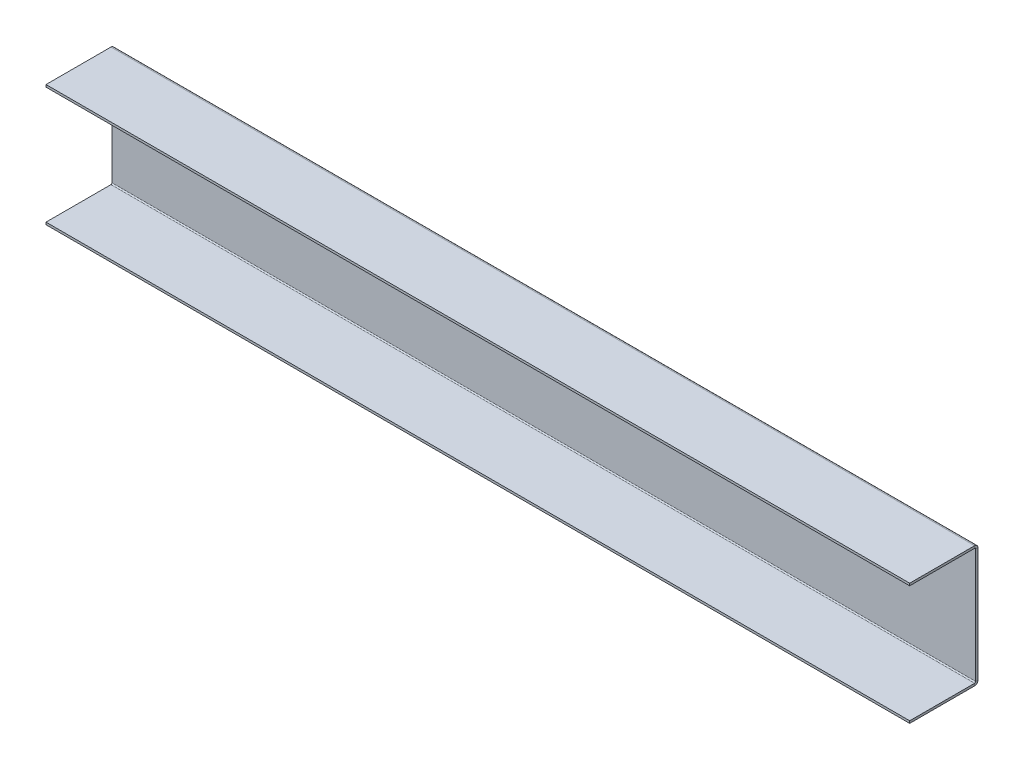
from build123d import *

# Parameters (mm, degrees)
SKETCH_1_W                         = 569
SKETCH_1_H                         = 80
SM_BASE_FLANGE_1_DEPTH             = 1.5
SM_EDGE_FLANGE_1_STRIP_W           = 7.4732
SM_EDGE_FLANGE_1_STRIP_H           = 1.5
SM_EDGE_FLANGE_1_STRIP_CUT_DEPTH   = 569
SM_EDGE_FLANGE_1_STRIP_2_W         = 7.4732
SM_EDGE_FLANGE_1_STRIP_2_H         = 1.5
SM_EDGE_FLANGE_1_STRIP_CUT_2_DEPTH = 569
SM_EDGE_FLANGE_1_DEPTH             = 569
SM_EDGE_FLANGE_1_BEND_DEPTH        = 569


# Sheet-metal steps are written as plain solids
with BuildPart() as part:
    # Sketch 1 → Базовая кромка1 (new body)
    with BuildSketch(Plane.XY):
        Rectangle(SKETCH_1_W, SKETCH_1_H)
    extrude(amount=-SM_BASE_FLANGE_1_DEPTH)

    # Ребро-кромка1 strip (across the edge) → Ребро-кромка1 strip cut (cut)
    with BuildSketch(Plane(origin=(284.5, 40, 0), x_dir=(0, -1, 0), z_dir=(-1, 0, 0))):
        with Locations((-1.5, -0.75)):
            Rectangle(SM_EDGE_FLANGE_1_STRIP_W, SM_EDGE_FLANGE_1_STRIP_H)
    extrude(amount=SM_EDGE_FLANGE_1_STRIP_CUT_DEPTH, mode=Mode.SUBTRACT)

    # Ребро-кромка1 strip 2 (across the edge) → Ребро-кромка1 strip cut 2 (cut)
    with BuildSketch(Plane(origin=(-284.5, -40, 0), x_dir=(0, 1, 0), z_dir=(1, 0, 0))):
        with Locations((-1.5, -0.75)):
            Rectangle(SM_EDGE_FLANGE_1_STRIP_2_W, SM_EDGE_FLANGE_1_STRIP_2_H)
    extrude(amount=SM_EDGE_FLANGE_1_STRIP_CUT_2_DEPTH, mode=Mode.SUBTRACT)

    # Ребро-кромка1 section (across the edge) → Ребро-кромка1 (add)
    with BuildSketch(Plane(origin=(284.5, 40, 0), x_dir=(0, -1, 0), z_dir=(-1, 0, 0))):
        with BuildLine():
            Line((0, 0.7366), (0, 43.5))
            Line((0, 43.5), (1.5, 43.5))
            Line((1.5, 43.5), (1.5, 0.7366))
            ThreePointArc((1.5, 0.7366), (1.715745145, 0.215745145), (2.2366, 0))
            Line((2.2366, 0), (2.2366, -1.5))
            ThreePointArc((2.2366, -1.5), (0.655084973, -0.844915027), (0, 0.7366))
        make_face()
    extrude(amount=SM_EDGE_FLANGE_1_DEPTH)

    # Ребро-кромка1 section 2 (across the edge) → Ребро-кромка1 bend (add)
    with BuildSketch(Plane(origin=(-284.5, -40, 0), x_dir=(0, 1, 0), z_dir=(1, 0, 0))):
        with BuildLine():
            Line((0, 0.7366), (0, 43.5))
            Line((0, 43.5), (1.5, 43.5))
            Line((1.5, 43.5), (1.5, 0.7366))
            ThreePointArc((1.5, 0.7366), (1.715745145, 0.215745145), (2.2366, 0))
            Line((2.2366, 0), (2.2366, -1.5))
            ThreePointArc((2.2366, -1.5), (0.655084973, -0.844915027), (0, 0.7366))
        make_face()
    extrude(amount=SM_EDGE_FLANGE_1_BEND_DEPTH)


solid = part.part
